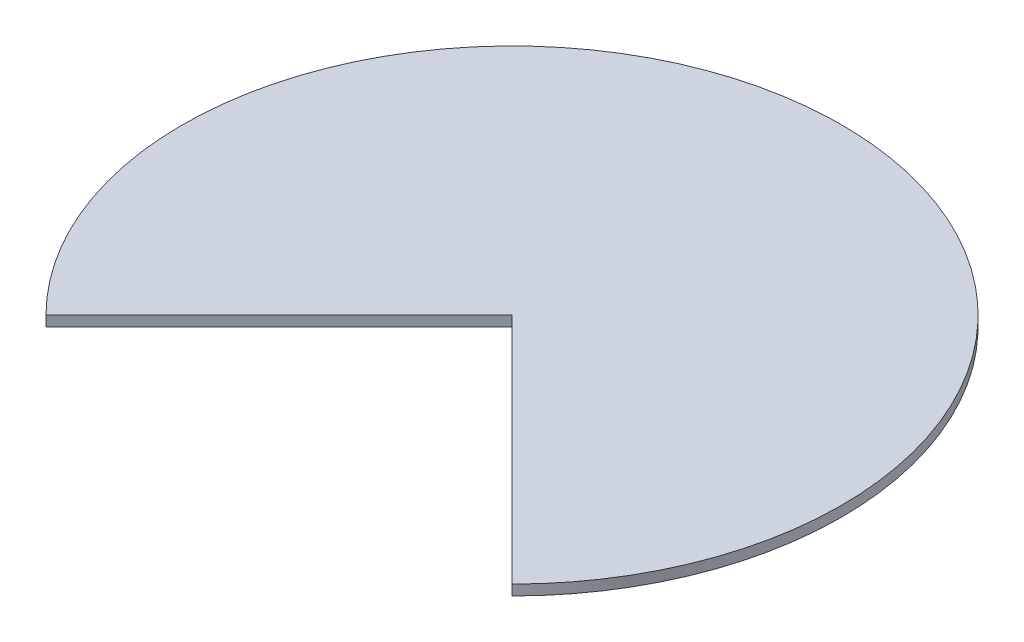
from build123d import *

# Parameters (mm, degrees)
BOSS_EXTRUDE1_DEPTH = 6.35


with BuildPart() as part:
    # Sketch1 → Boss-Extrude1 (new body)
    with BuildSketch(Plane(origin=(0, 0, 0), x_dir=(1, 0, 0), z_dir=(0, 1, 0))):
        with BuildLine():
            Line((0, 0), (-143.684097937, -143.684097937))
            ThreePointArc((-143.684097937, -143.684097937), (0, 203.2), (143.684097937, -143.684097937))
            Line((143.684097937, -143.684097937), (0, 0))
        make_face()
    extrude(amount=BOSS_EXTRUDE1_DEPTH)


solid = part.part
